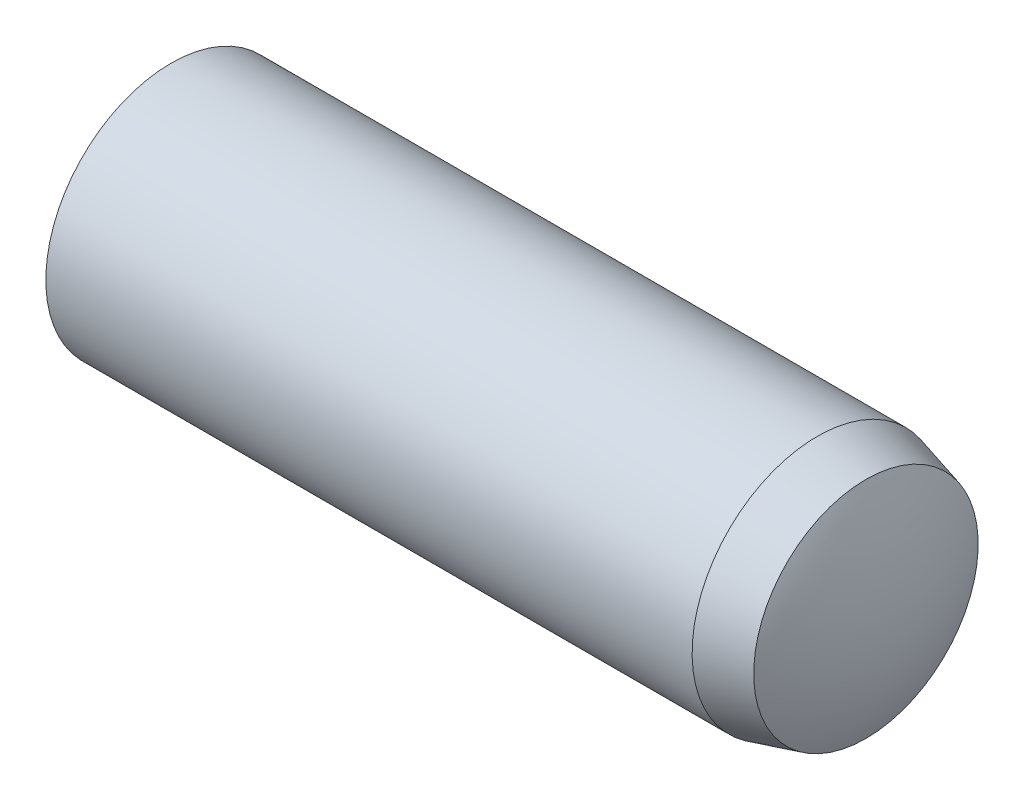
from build123d import *


with BuildPart() as part:
    # BodySke → Body (revolve)
    with BuildSketch(Plane.XY):
        with BuildLine():
            Line((27, 5), (28.94028425, 4.480102402))
            ThreePointArc((28.94028425, 4.480102402), (29.731465524, 2.30186419), (30, 0))
            Line((30, 0), (0, 0))
            ThreePointArc((0, 0), (0.30419989, 2.570992026), (1.2, 5))
            Line((1.2, 5), (27, 5))
        make_face()
    revolve(axis=Axis((0, 0, 0), (1, 0, 0)))


solid = part.part
